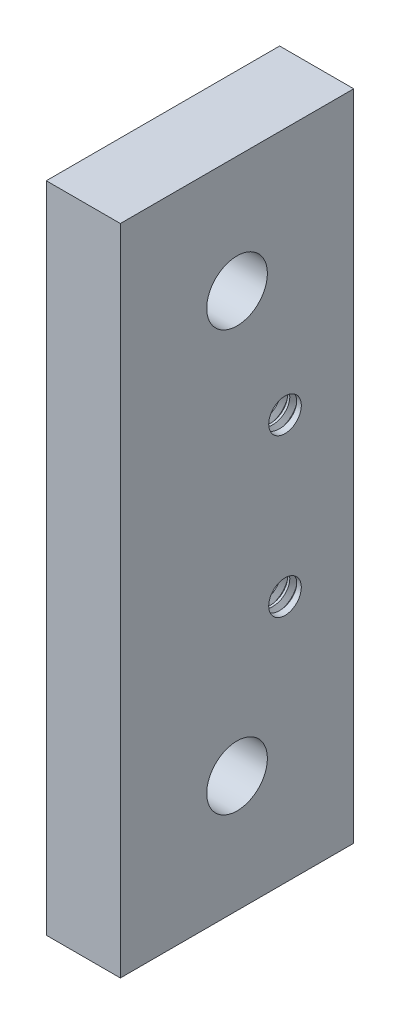
from build123d import *

# Parameters (mm, degrees)
BOSS_EXTRUDE1_DEPTH      = 3.175
BOSS_EXTRUDE1_DEPTH_BACK = 3.175
SKETCH1_W                = 20
SKETCH1_H                = 56
SKETCH1_R                = 2.6
SKETCH1_R_2              = 1.397
THREAD1_PITCH            = 0.79375
THREAD2_PITCH            = 0.79375


with BuildPart() as part:
    # Sketch1 → Boss-Extrude1 (new, two sides: drawn at the far end of the back side and taken through both)
    with BuildSketch(Plane(origin=(0, 0, 0), x_dir=(0, 0, -1), z_dir=(1, 0, 0)).offset(-BOSS_EXTRUDE1_DEPTH_BACK)):
        Rectangle(SKETCH1_W, SKETCH1_H)
        with Locations((0, 18)):
            Circle(SKETCH1_R, mode=Mode.SUBTRACT)
        with Locations((0, -18)):
            Circle(SKETCH1_R, mode=Mode.SUBTRACT)
        with Locations((4.110065, 6.746875)):
            Circle(SKETCH1_R_2, mode=Mode.SUBTRACT)
        with Locations((4.110065, -6.746875)):
            Circle(SKETCH1_R_2, mode=Mode.SUBTRACT)
    extrude(amount=BOSS_EXTRUDE1_DEPTH + BOSS_EXTRUDE1_DEPTH_BACK)

    # Thread1: the profile of Thread Profile1 profile screwed along a right-hand helix of 12.598425 turns, 8 arcs to a turn; built about Z, then put on its axis
    thread1_z = Axis((0, 0, 0), (0, 0, 1))
    thread1_corners = [(1.3967, 0, -0.000173205), (1.826629788, 0, 0.248046874), (1.826629788, 0, 0.347265624), (1.3967, 0, 0.595485703)]
    with BuildLine(mode=Mode.PRIVATE) as thread1_profile:
        Line(thread1_corners[0], thread1_corners[1])
        Line(thread1_corners[1], thread1_corners[2])
        Line(thread1_corners[2], thread1_corners[3])
        Line(thread1_corners[3], thread1_corners[0])
    thread1_cap = Face(thread1_profile.wire())
    thread1_turn_angles = [0, 22.5, 45, 67.5, 90, 112.5, 135, 157.5, 180, 202.5, 225, 247.5, 270, 292.5, 315, 337.5, 360]
    thread1_turn_weights = [1, 0.9238795325112867, 1, 0.9238795325112867, 1, 0.9238795325112867, 1, 0.9238795325112867, 1, 0.9238795325112867, 1, 0.9238795325112867, 1, 0.9238795325112867, 1, 0.9238795325112867, 1]
    thread1_turn_rails = [Edge.make_bspline([Vector(p[0], p[1], 0).rotate(thread1_z, thread1_turn_angles[k]) / thread1_turn_weights[k] + Vector(0, 0, p[2] + THREAD1_PITCH * thread1_turn_angles[k] / 360) for k in range(17)], [0, 0, 0, 1, 1, 2, 2, 3, 3, 4, 4, 5, 5, 6, 6, 7, 7, 8, 8, 8], 2, thread1_turn_weights) for p in thread1_corners]
    thread1_turn_sides = [Face.make_surface_from_curves(thread1_turn_rails[p[0]], thread1_turn_rails[p[1]]) for p in [(0, 1), (1, 2), (2, 3), (3, 0)]]
    thread1_last_angles = [4320, 4342.5, 4365, 4387.5, 4410, 4432.5, 4455, 4477.5, 4500, 4517.716535433, 4535.433070866]
    thread1_last_weights = [1, 0.9238795325112867, 1, 0.9238795325112867, 1, 0.9238795325112867, 1, 0.9238795325112867, 1, 0.9525736983244454, 1]
    thread1_last_rails = [Edge.make_bspline([Vector(p[0], p[1], 0).rotate(thread1_z, thread1_last_angles[k]) / thread1_last_weights[k] + Vector(0, 0, p[2] + THREAD1_PITCH * thread1_last_angles[k] / 360) for k in range(11)], [0, 0, 0, 1, 1, 2, 2, 3, 3, 4, 4, 5, 5, 5], 2, thread1_last_weights) for p in thread1_corners]
    thread1_last_sides = [Face.make_surface_from_curves(thread1_last_rails[p[0]], thread1_last_rails[p[1]]) for p in [(0, 1), (1, 2), (2, 3), (3, 0)]]
    thread1 = Plane(origin=(3.175, 6.746875, -4.110065), x_dir=(0, 0, 1), z_dir=(-1, 0, 0)) * Solid(Shell([*[p.moved(Location((0, 0, THREAD1_PITCH * i))) for i in range(12) for p in thread1_turn_sides], *thread1_last_sides, thread1_cap, thread1_cap.rotate(thread1_z, 4535.433070866).moved(Location((0, 0, THREAD1_PITCH * 4535.433070866 / 360)))]))
    add(thread1, mode=Mode.SUBTRACT)

    # Thread2: the profile of Thread Profile2 profile screwed along a right-hand helix of 12.598425 turns, 8 arcs to a turn; built about Z, then put on its axis
    thread2_z = Axis((0, 0, 0), (0, 0, 1))
    thread2_corners = [(1.3967, 0, -0.000173205), (1.826629788, 0, 0.248046874), (1.826629788, 0, 0.347265624), (1.3967, 0, 0.595485703)]
    with BuildLine(mode=Mode.PRIVATE) as thread2_profile:
        Line(thread2_corners[0], thread2_corners[1])
        Line(thread2_corners[1], thread2_corners[2])
        Line(thread2_corners[2], thread2_corners[3])
        Line(thread2_corners[3], thread2_corners[0])
    thread2_cap = Face(thread2_profile.wire())
    thread2_turn_angles = [0, 22.5, 45, 67.5, 90, 112.5, 135, 157.5, 180, 202.5, 225, 247.5, 270, 292.5, 315, 337.5, 360]
    thread2_turn_weights = [1, 0.9238795325112867, 1, 0.9238795325112867, 1, 0.9238795325112867, 1, 0.9238795325112867, 1, 0.9238795325112867, 1, 0.9238795325112867, 1, 0.9238795325112867, 1, 0.9238795325112867, 1]
    thread2_turn_rails = [Edge.make_bspline([Vector(p[0], p[1], 0).rotate(thread2_z, thread2_turn_angles[k]) / thread2_turn_weights[k] + Vector(0, 0, p[2] + THREAD2_PITCH * thread2_turn_angles[k] / 360) for k in range(17)], [0, 0, 0, 1, 1, 2, 2, 3, 3, 4, 4, 5, 5, 6, 6, 7, 7, 8, 8, 8], 2, thread2_turn_weights) for p in thread2_corners]
    thread2_turn_sides = [Face.make_surface_from_curves(thread2_turn_rails[p[0]], thread2_turn_rails[p[1]]) for p in [(0, 1), (1, 2), (2, 3), (3, 0)]]
    thread2_last_angles = [4320, 4342.5, 4365, 4387.5, 4410, 4432.5, 4455, 4477.5, 4500, 4517.716535433, 4535.433070866]
    thread2_last_weights = [1, 0.9238795325112867, 1, 0.9238795325112867, 1, 0.9238795325112867, 1, 0.9238795325112867, 1, 0.9525736983244454, 1]
    thread2_last_rails = [Edge.make_bspline([Vector(p[0], p[1], 0).rotate(thread2_z, thread2_last_angles[k]) / thread2_last_weights[k] + Vector(0, 0, p[2] + THREAD2_PITCH * thread2_last_angles[k] / 360) for k in range(11)], [0, 0, 0, 1, 1, 2, 2, 3, 3, 4, 4, 5, 5, 5], 2, thread2_last_weights) for p in thread2_corners]
    thread2_last_sides = [Face.make_surface_from_curves(thread2_last_rails[p[0]], thread2_last_rails[p[1]]) for p in [(0, 1), (1, 2), (2, 3), (3, 0)]]
    thread2 = Plane(origin=(3.175, -6.746875, -4.110065), x_dir=(0, 0, 1), z_dir=(-1, 0, 0)) * Solid(Shell([*[p.moved(Location((0, 0, THREAD2_PITCH * i))) for i in range(12) for p in thread2_turn_sides], *thread2_last_sides, thread2_cap, thread2_cap.rotate(thread2_z, 4535.433070866).moved(Location((0, 0, THREAD2_PITCH * 4535.433070866 / 360)))]))
    add(thread2, mode=Mode.SUBTRACT)


solid = part.part
